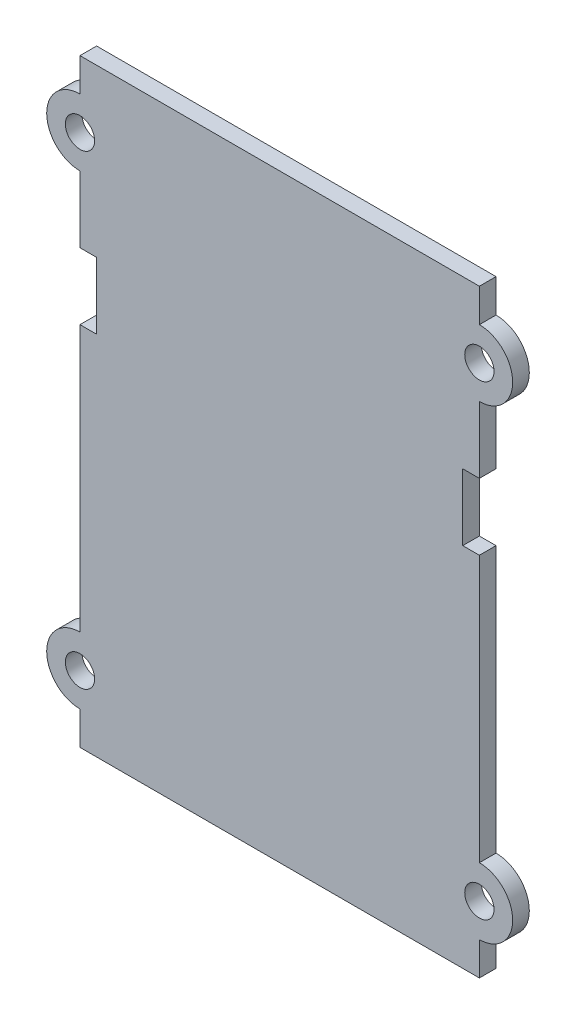
from build123d import *

# Parameters (mm, degrees)
SKETCH1_R           = 2.2
BOSS_EXTRUDE1_DEPTH = 2.5


with BuildPart() as part:
    # Sketch1 → Boss-Extrude1 (new body)
    with BuildSketch(Plane.XY):
        with BuildLine():
            Line((0, 105), (0, 110))
            Line((0, 110), (60, 110))
            Line((60, 110), (60, 105))
            ThreePointArc((60, 105), (65, 100), (60, 95))
            Line((60, 95), (60, 85))
            Line((60, 85), (57.5, 85))
            Line((57.5, 85), (57.5, 75))
            Line((57.5, 75), (60, 75))
            Line((60, 75), (60, 35))
            ThreePointArc((60, 35), (65, 30), (60, 25))
            Line((60, 25), (60, 20))
            Line((60, 20), (0, 20))
            Line((0, 20), (0, 25))
            ThreePointArc((0, 25), (-5, 30), (0, 35))
            Line((0, 35), (0, 75))
            Line((0, 75), (2.5, 75))
            Line((2.5, 75), (2.5, 85))
            Line((2.5, 85), (0, 85))
            Line((0, 85), (0, 95))
            ThreePointArc((0, 95), (-5, 100), (0, 105))
        make_face()
        with Locations((0, 100)):
            Circle(SKETCH1_R, mode=Mode.SUBTRACT)
        with Locations((0, 30)):
            Circle(SKETCH1_R, mode=Mode.SUBTRACT)
        with Locations((60, 30)):
            Circle(SKETCH1_R, mode=Mode.SUBTRACT)
        with Locations((60, 100)):
            Circle(SKETCH1_R, mode=Mode.SUBTRACT)
    extrude(amount=BOSS_EXTRUDE1_DEPTH)


solid = part.part
